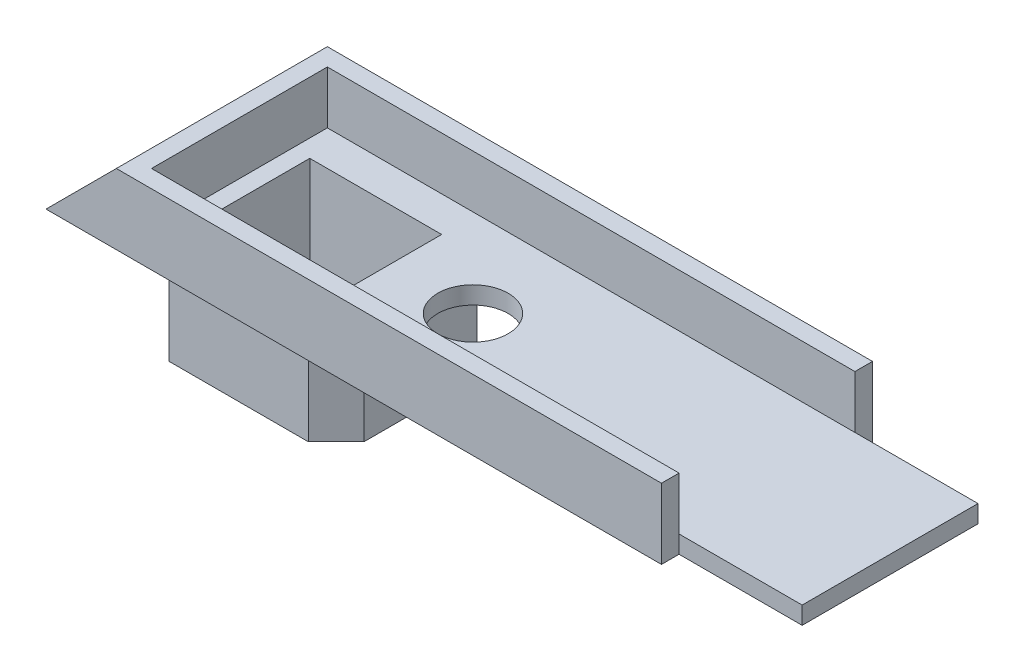
from build123d import *

# Parameters (mm, degrees)
EXTRUDE_1_DEPTH     = 1
EXTRUDE_2_DEPTH     = 6
SKETCH_3_R          = 2
CUT_EXTRUDE_1_DEPTH = 1
EXTRUDE_3_DEPTH     = 3
EXTRUDE_4_DEPTH     = 12


with BuildPart() as part:
    # 草图1 → 凸台-拉伸1 (new body)
    with BuildSketch(Plane(origin=(0, 0, 0), x_dir=(1, 0, 0), z_dir=(0, 1, 0))):
        Polygon((23.47582205, -4.484524381), (23.47582205, -14.484524381), (16.47582205, -14.484524381), (16.47582205, -15.484524381), (2.97582205, -15.484524381), (-4.02417795, -15.484524381), (-14.52417795, -15.484524381), (-14.52417795, -3.484524381), (-4.02417795, -3.484524381), (2.97582205, -3.484524381), (16.47582205, -3.484524381), (16.47582205, -4.484524381), align=None)
        Polygon((-12.52417795, -6.484524381), (-12.52417795, -12.484524381), (-6.02417795, -12.484524381), (-5.02417795, -11.484524381), (-5.02417795, -6.484524381), align=None, mode=Mode.SUBTRACT)
    extrude(amount=EXTRUDE_1_DEPTH)

    # 草图2 → 凸台-拉伸2 (add)
    with BuildSketch(Plane.XZ):
        Polygon((-13.52417795, 5.484524381), (-13.52417795, 13.484524381), (-5.609964387, 13.484524381), (-4.02417795, 11.898737944), (-4.02417795, 5.484524381), align=None)
        Polygon((-12.52417795, 12.484524381), (-6.02417795, 12.484524381), (-5.02417795, 11.484524381), (-5.02417795, 6.484524381), (-12.52417795, 6.484524381), align=None, mode=Mode.SUBTRACT)
    extrude(amount=EXTRUDE_2_DEPTH)

    # 草图3 → 切除-拉伸1 (cut)
    with BuildSketch(Plane(origin=(0, 1, 0), x_dir=(1, 0, 0), z_dir=(0, 1, 0))):
        with Locations((-0.24417795, -9.484524381)):
            Circle(SKETCH_3_R)
    extrude(amount=-CUT_EXTRUDE_1_DEPTH, mode=Mode.SUBTRACT)

    # 草图4 → 凸台-拉伸3 (add)
    with BuildSketch(Plane(origin=(0, 1, 0), x_dir=(1, 0, 0), z_dir=(0, 1, 0))):
        Polygon((-14.52417795, -3.484524381), (16.47582205, -3.484524381), (16.47582205, -4.484524381), (-13.52417795, -4.484524381), (-13.52417795, -14.484524381), (16.47582205, -14.484524381), (16.47582205, -15.484524381), (-14.52417795, -15.484524381), align=None)
    extrude(amount=EXTRUDE_3_DEPTH)

    # 草图7 → 凸台-拉伸4 (add)
    with BuildSketch(Plane.XY.offset(15.484524381)):
        Polygon((-14.52417795, 0), (-14.52417795, 4), (-18.52417795, 0), align=None)
    extrude(amount=-EXTRUDE_4_DEPTH)


solid = part.part
